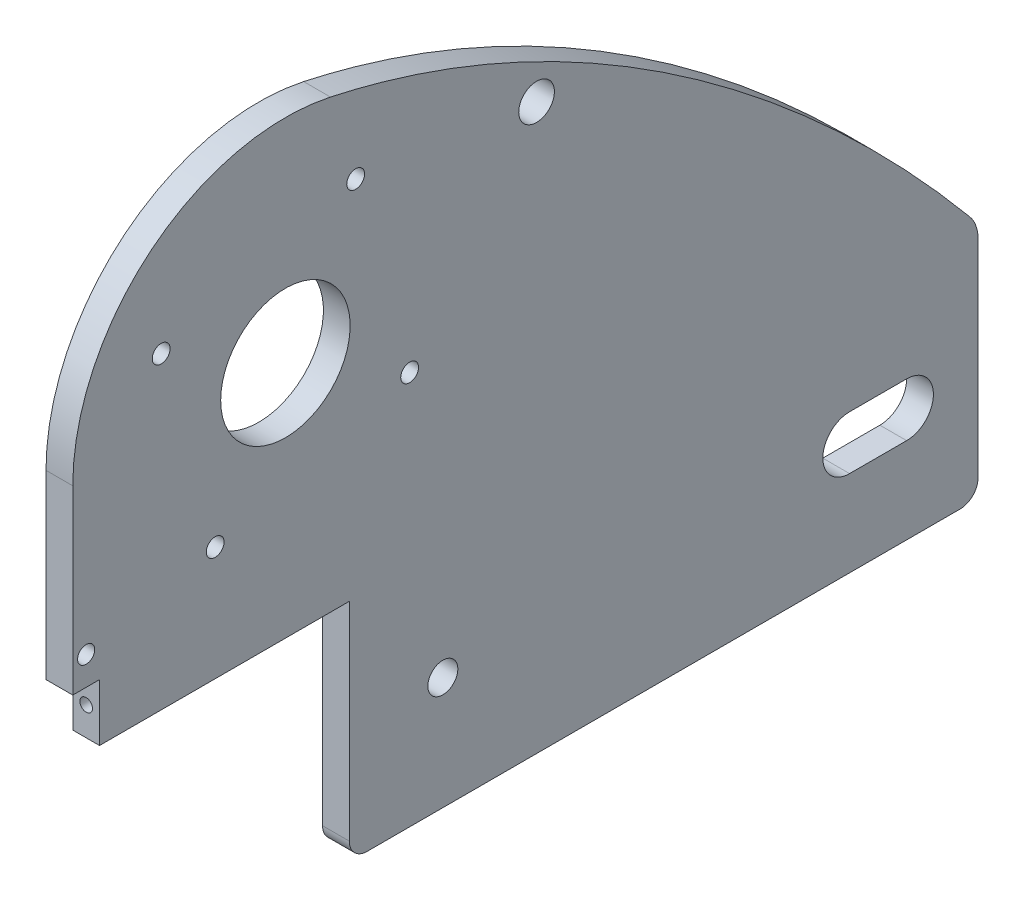
from build123d import *

# Parameters (mm, degrees)
SKETCH1_R           = 1.5875
SKETCH1_R_2         = 2.667
SKETCH1_R_3         = 1.524
SKETCH1_R_4         = 11.522750336
SKETCH1_R_5         = 3.175
BOSS_EXTRUDE1_DEPTH = 4.7625
SKETCH2_R           = 1.1303
CUT_EXTRUDE1_DEPTH  = 6.35


with BuildPart() as part:
    # Sketch1 → Boss-Extrude1 (new body)
    with BuildSketch(Plane(origin=(0, 0, 0), x_dir=(0, 0, -1), z_dir=(1, 0, 0))):
        with BuildLine():
            Line((-28.170295117, 0), (77.382795117, 0))
            ThreePointArc((77.382795117, 0), (79.627859148, 0.92993597), (80.557795117, 3.175))
            Line((80.557795117, 3.175), (80.557795117, 40.132))
            ThreePointArc((80.557795117, 40.132), (80.179263316, 42.291645237), (79.088797464, 44.193811922))
            add(Edge.make_bspline(
                [(79.088797464, 44.193811922), (50.66748195, 78.347167709), (10.80796538, 109.687612786), (-34.696393838, 119.542430976)],
                knots=[0, 0, 0, 0, 1, 1, 1, 1], degree=3))
            ThreePointArc((-34.696393838, 119.542430976), (-66.471117292, 112.010601135), (-80.557795117, 82.55))
            Line((-80.557795117, 82.55), (-80.557795117, 50.292))
            Line((-80.557795117, 50.292), (-75.795295117, 50.292))
            Line((-75.795295117, 50.292), (-75.795295117, 40.132))
            Line((-75.795295117, 40.132), (-31.345295117, 40.132))
            Line((-31.345295117, 40.132), (-31.345295117, 3.175))
            ThreePointArc((-31.345295117, 3.175), (-30.415359148, 0.92993597), (-28.170295117, 0))
        make_face()
        with Locations((-55.209041359, 60.43939525)):
            Circle(SKETCH1_R, mode=Mode.SUBTRACT)
        with Locations((-14.692204883, 20.066)):
            Circle(SKETCH1_R_2, mode=Mode.SUBTRACT)
        with Locations((-20.597190367, 70.048753759)):
            Circle(SKETCH1_R, mode=Mode.SUBTRACT)
        with Locations((-64.818399868, 95.051246241)):
            Circle(SKETCH1_R, mode=Mode.SUBTRACT)
        with Locations((-30.206548876, 104.66060475)):
            Circle(SKETCH1_R, mode=Mode.SUBTRACT)
        with Locations((-78.176545117, 55.372)):
            Circle(SKETCH1_R_3, mode=Mode.SUBTRACT)
        with Locations((-42.707795117, 82.55)):
            Circle(SKETCH1_R_4, mode=Mode.SUBTRACT)
        with Locations((1.992204883, 100.457)):
            Circle(SKETCH1_R_5, mode=Mode.SUBTRACT)
        with BuildLine():
            Line((67.857795117, 15.3035), (57.697795117, 15.3035))
            ThreePointArc((57.697795117, 15.3035), (52.935295117, 20.066), (57.697795117, 24.8285))
            Line((57.697795117, 24.8285), (67.857795117, 24.8285))
            ThreePointArc((67.857795117, 24.8285), (72.620295117, 20.066), (67.857795117, 15.3035))
        make_face(mode=Mode.SUBTRACT)
    extrude(amount=BOSS_EXTRUDE1_DEPTH)

    # Sketch2 → Cut-Extrude1 (cut)
    with BuildSketch(Plane.XY.offset(75.795295117)):
        with Locations((2.38125, 45.212)):
            Circle(SKETCH2_R)
    extrude(amount=-CUT_EXTRUDE1_DEPTH, mode=Mode.SUBTRACT)


solid = part.part
